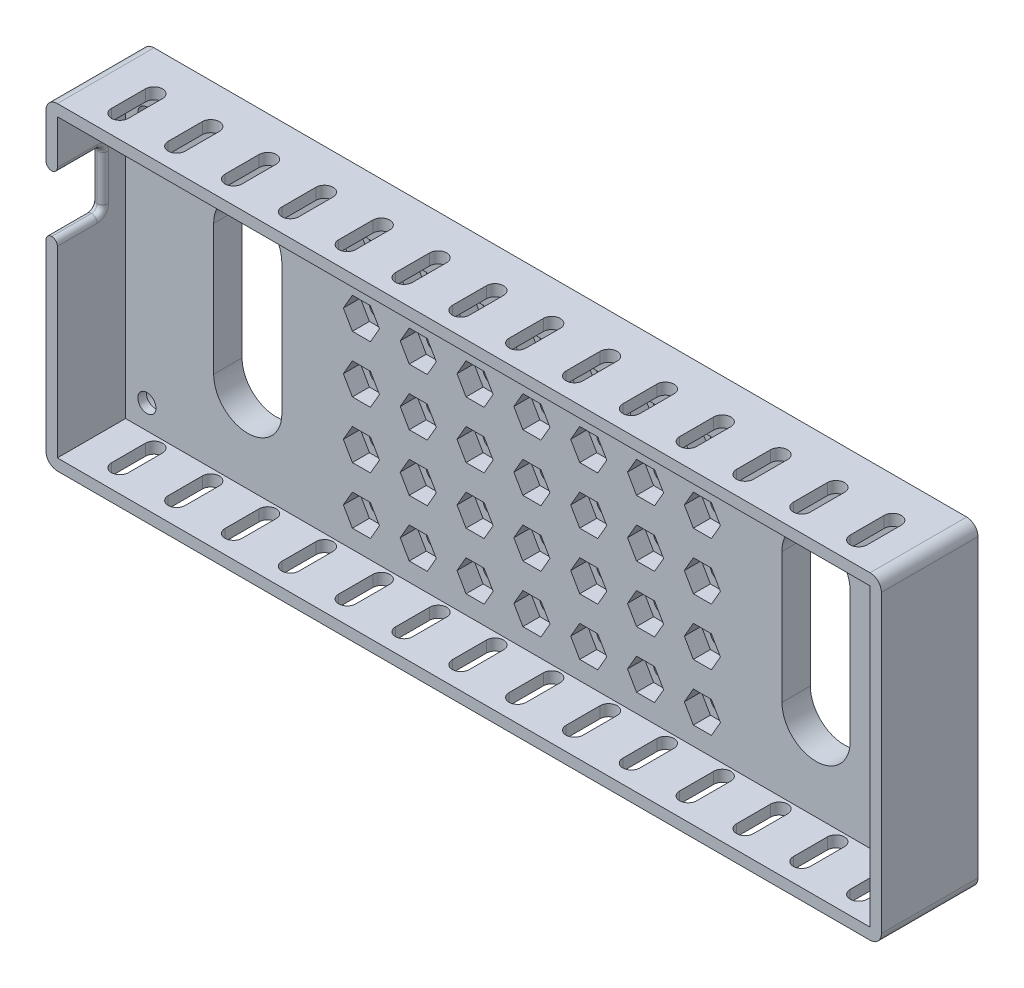
from build123d import *

# Parameters (mm, degrees)
SKETCH2_W            = 143
SKETCH2_H            = 52
BOSS_EXTRUDE1_DEPTH  = 5
SKETCH2_4_W          = 147
SKETCH2_4_H          = 56
SKETCH2_4_W_2        = 143
SKETCH2_4_H_2        = 52
BOSS_EXTRUDE2_DEPTH  = 17
SKETCH4_R            = 1.6
CUT_EXTRUDE1_DEPTH   = 16
SKETCH4_3_R          = 4
SKETCH4_3_R_2        = 1.6
CUT_EXTRUDE2_DEPTH   = 3.5
SKETCH5_R            = 1.6
CUT_EXTRUDE3_DEPTH   = 81.468938107
LPATTERN1_COUNT      = 7
LPATTERN1_PITCH      = 10
LPATTERN1_COUNT_DIR2 = 5
LPATTERN1_PITCH_DIR2 = 10
CUT_EXTRUDE4_DEPTH   = 3
LPATTERN2_COUNT      = 7
LPATTERN2_PITCH      = 10
LPATTERN2_COUNT_DIR2 = 5
LPATTERN2_PITCH_DIR2 = 10
CUT_EXTRUDE5_DEPTH   = 62
LPATTERN3_COUNT      = 14
LPATTERN3_PITCH      = 10
SKETCH9_W            = 8
SKETCH9_H            = 10
CUT_EXTRUDE6_DEPTH   = 62
FILLET1_R            = 1
FILLET2_R            = 2
CUT_EXTRUDE7_DEPTH   = 62


with BuildPart() as part:
    # Sketch2 → Boss-Extrude1 (new body)
    with BuildSketch(Plane.XY):
        Rectangle(SKETCH2_W, SKETCH2_H)
    extrude(amount=BOSS_EXTRUDE1_DEPTH)

    # Sketch2<4> → Boss-Extrude2 (add)
    with BuildSketch(Plane.XY):
        Rectangle(SKETCH2_4_W, SKETCH2_4_H)
        Rectangle(SKETCH2_4_W_2, SKETCH2_4_H_2, mode=Mode.SUBTRACT)
    extrude(amount=BOSS_EXTRUDE2_DEPTH)

    # Sketch4 → Cut-Extrude1 (cut)
    with BuildSketch(Plane(origin=(0, 0, 0), x_dir=(-1, 0, 0), z_dir=(0, 0, -1))):
        with Locations((-67.75, 21.75)):
            Circle(SKETCH4_R)
        with Locations((-67.75, -21.75)):
            Circle(SKETCH4_R)
        with Locations((67.75, -21.75)):
            Circle(SKETCH4_R)
        with Locations((67.75, 21.75)):
            Circle(SKETCH4_R)
    extrude(amount=-CUT_EXTRUDE1_DEPTH, mode=Mode.SUBTRACT)

    # Sketch4<3> → Cut-Extrude2 (cut)
    # profile 1 of 4: a face of its own
    with BuildSketch(Plane(origin=(0, 0, 0), x_dir=(-1, 0, 0), z_dir=(0, 0, -1))):
        with Locations((-67.75, 21.75)):
            Circle(SKETCH4_3_R)
        with Locations((-67.75, 21.75)):
            Circle(SKETCH4_3_R_2, mode=Mode.SUBTRACT)
    # profile 2 of 4: a face of its own
    with BuildSketch(Plane(origin=(0, 0, 0), x_dir=(-1, 0, 0), z_dir=(0, 0, -1))):
        with Locations((67.75, 21.75)):
            Circle(SKETCH4_3_R)
        with Locations((67.75, 21.75)):
            Circle(SKETCH4_3_R_2, mode=Mode.SUBTRACT)
    # profile 3 of 4: a face of its own
    with BuildSketch(Plane(origin=(0, 0, 0), x_dir=(-1, 0, 0), z_dir=(0, 0, -1))):
        with Locations((67.75, -21.75)):
            Circle(SKETCH4_3_R)
        with Locations((67.75, -21.75)):
            Circle(SKETCH4_3_R_2, mode=Mode.SUBTRACT)
    # profile 4 of 4: a face of its own
    with BuildSketch(Plane(origin=(0, 0, 0), x_dir=(-1, 0, 0), z_dir=(0, 0, -1))):
        with Locations((-67.75, -21.75)):
            Circle(SKETCH4_3_R)
        with Locations((-67.75, -21.75)):
            Circle(SKETCH4_3_R_2, mode=Mode.SUBTRACT)
    extrude(amount=-CUT_EXTRUDE2_DEPTH, mode=Mode.SUBTRACT)

    # Sketch5 → Cut-Extrude3 (cut, through all)
    with BuildSketch(Plane(origin=(0, 0, 0), x_dir=(-1, 0, 0), z_dir=(0, 0, -1))):
        with Locations((-30, 20)):
            Circle(SKETCH5_R)
    cut_extrude3 = extrude(amount=-CUT_EXTRUDE3_DEPTH, mode=Mode.SUBTRACT)

    # LPattern1: Cut-Extrude3 7 × 5
    with Locations(*[(-i * LPATTERN1_PITCH, -j * LPATTERN1_PITCH_DIR2, 0) for i in range(LPATTERN1_COUNT) for j in range(LPATTERN1_COUNT_DIR2) if (i, j) != (0, 0)]):
        add(cut_extrude3, mode=Mode.SUBTRACT)

    # Sketch6 → Cut-Extrude4 (cut)
    with BuildSketch(Plane.XY.offset(5)):
        Polygon((-26.824573519, 20), (-28.41228676, 22.75), (-31.58771324, 22.75), (-33.175426481, 20), (-31.58771324, 17.25), (-28.41228676, 17.25), align=None)
    cut_extrude4 = extrude(amount=-CUT_EXTRUDE4_DEPTH, mode=Mode.SUBTRACT)

    # LPattern2: Cut-Extrude4 7 × 5
    with Locations(*[(i * LPATTERN2_PITCH, -j * LPATTERN2_PITCH_DIR2, 0) for i in range(LPATTERN2_COUNT) for j in range(LPATTERN2_COUNT_DIR2) if (i, j) != (0, 0)]):
        add(cut_extrude4, mode=Mode.SUBTRACT)

    # Sketch7 → Cut-Extrude5 (cut)
    with BuildSketch(Plane(origin=(0, -28, 0), x_dir=(-1, 0, 0), z_dir=(0, -1, 0))):
        with BuildLine():
            Line((63, -13), (63, -7))
            ThreePointArc((63, -7), (64.5, -5.5), (66, -7))
            Line((66, -7), (66, -13))
            ThreePointArc((66, -13), (64.5, -14.5), (63, -13))
        make_face()
    cut_extrude5 = extrude(amount=-CUT_EXTRUDE5_DEPTH, mode=Mode.SUBTRACT)

    # LPattern3: Cut-Extrude5 ×14
    with Locations(*[(i * LPATTERN3_PITCH, 0, 0) for i in range(1, LPATTERN3_COUNT)]):
        add(cut_extrude5, mode=Mode.SUBTRACT)

    # Sketch9 → Cut-Extrude6 (cut)
    with BuildSketch(Plane.ZY.offset(73.5)):
        with Locations((13, 12.25)):
            Rectangle(SKETCH9_W, SKETCH9_H)
    extrude(amount=-CUT_EXTRUDE6_DEPTH, mode=Mode.SUBTRACT)

    # Fillet1
    # the kernel refuses this fillet: 1 mm, written as the material it adds along each edge
    with BuildSketch(Plane(origin=(-73.5, 7.25, 9), x_dir=(0, 1, 0), z_dir=(1, 0, 0)), Plane(origin=(-73.5, 17.25, 9), x_dir=(0, 0, 1), z_dir=(1, 0, 0))) as fillet1_piece_1:
        with BuildLine():
            CenterArc((FILLET1_R, FILLET1_R), FILLET1_R, 180, 90)
            Line((0, FILLET1_R), (0, 0))
            Line((0, 0), (FILLET1_R, 0))
        make_face()
    extrude(amount=2)
    # the kernel refuses this fillet: 1 mm, written as the material it takes off along each edge
    # the kernel refuses this fillet: 1 mm, written as the material it takes off along each edge
    with BuildSketch(Plane(origin=(-71.5, 16.25, 9), x_dir=(-1, 0, 0), z_dir=(0, -1, 0)), Plane(origin=(-73.5, 16.25, 9), x_dir=(0, 0, -1), z_dir=(0, -1, 0))) as fillet1_3_piece_1:
        with BuildLine():
            CenterArc((FILLET1_R, FILLET1_R), FILLET1_R, 180, 90)
            Line((0, FILLET1_R), (0, 0))
            Line((0, 0), (FILLET1_R, 0))
        make_face()
    extrude(amount=8, mode=Mode.SUBTRACT)
    with BuildSketch(Plane(origin=(-71.5, 17.25, 19.5), x_dir=(-1, 0, 0), z_dir=(0, 0, -1)), Plane(origin=(-71.5, 7.25, 10), x_dir=(-1, 0, 0), z_dir=(0, 0, 1)), Plane(origin=(-73.5, 7.25, 10), x_dir=(0, -1, 0), z_dir=(0, 0, 1)), Plane(origin=(-73.5, 17.25, 19.5), x_dir=(0, 1, 0), z_dir=(0, 0, -1))) as fillet1_3_piece_2:
        with BuildLine():
            CenterArc((FILLET1_R, FILLET1_R), FILLET1_R, 180, 90)
            Line((0, FILLET1_R), (0, 0))
            Line((0, 0), (FILLET1_R, 0))
        make_face()
    extrude(amount=9.5, mode=Mode.SUBTRACT)
    with BuildSketch(Plane(origin=(-73.5, 16.25, 10), x_dir=(0, 1, 0), z_dir=(0, 0, 1))) as fillet1_3_piece_3:
        with BuildLine():
            CenterArc((1 + FILLET1_R, -FILLET1_R), FILLET1_R, 90, 90)
            Line((1, -FILLET1_R), (1, 0))
            Line((1, 0), (1 + FILLET1_R, 0))
        make_face()
    revolve(axis=Axis((-73.5, 16.25, 10), (-1, 0, 0)), revolution_arc=90, mode=Mode.SUBTRACT)
    with BuildSketch(Plane(origin=(-73.5, 8.25, 10), x_dir=(0, 0, -1), z_dir=(0, 1, 0))) as fillet1_3_piece_4:
        with BuildLine():
            CenterArc((1 + FILLET1_R, -FILLET1_R), FILLET1_R, 90, 90)
            Line((1, -FILLET1_R), (1, 0))
            Line((1, 0), (1 + FILLET1_R, 0))
        make_face()
    revolve(axis=Axis((-73.5, 8.25, 10), (-1, 0, 0)), revolution_arc=90, mode=Mode.SUBTRACT)
    with BuildSketch(Plane(origin=(-71.5, 8.25, 10), x_dir=(0, 0, -1), z_dir=(0, 1, 0))) as fillet1_3_piece_5:
        with BuildLine():
            CenterArc((1 + FILLET1_R, FILLET1_R), FILLET1_R, 180, 90)
            Line((1, FILLET1_R), (1, 0))
            Line((1, 0), (1 + FILLET1_R, 0))
        make_face()
    revolve(axis=Axis((-71.5, 8.25, 10), (-1, 0, 0)), revolution_arc=90, mode=Mode.SUBTRACT)
    with BuildSketch(Plane(origin=(-71.5, 16.25, 10), x_dir=(0, 1, 0), z_dir=(0, 0, 1))) as fillet1_3_piece_6:
        with BuildLine():
            CenterArc((1 + FILLET1_R, FILLET1_R), FILLET1_R, 180, 90)
            Line((1, FILLET1_R), (1, 0))
            Line((1, 0), (1 + FILLET1_R, 0))
        make_face()
    revolve(axis=Axis((-71.5, 16.25, 10), (-1, 0, 0)), revolution_arc=90, mode=Mode.SUBTRACT)

    # Fillet2
    fillet2_edges = [part.edges().sort_by_distance(p)[0] for p in [
        (-73.5, 28, 8.5),
        (-73.5, -28, 8.5),
        (73.5, -28, 8.5),
        (73.5, 28, 8.5),
    ]]
    fillet(fillet2_edges, radius=FILLET2_R)

    # Sketch10 → Cut-Extrude7 (cut)
    with BuildSketch(Plane(origin=(0, 0, 0), x_dir=(-1, 0, 0), z_dir=(0, 0, -1))):
        with BuildLine():
            Line((44, -11.5), (44, 11.5))
            ThreePointArc((44, 11.5), (50, 17.5), (56, 11.5))
            Line((56, 11.5), (56, -11.5))
            ThreePointArc((56, -11.5), (50, -17.5), (44, -11.5))
        make_face()
    cut_extrude7 = extrude(amount=-CUT_EXTRUDE7_DEPTH, mode=Mode.SUBTRACT)

    # Mirror1: Cut-Extrude7 across plane
    add(cut_extrude7.mirror(Plane(origin=(0, 0, 0), x_dir=(0, 0, 1), z_dir=(1, 0, 0))), mode=Mode.SUBTRACT)


solid = part.part
